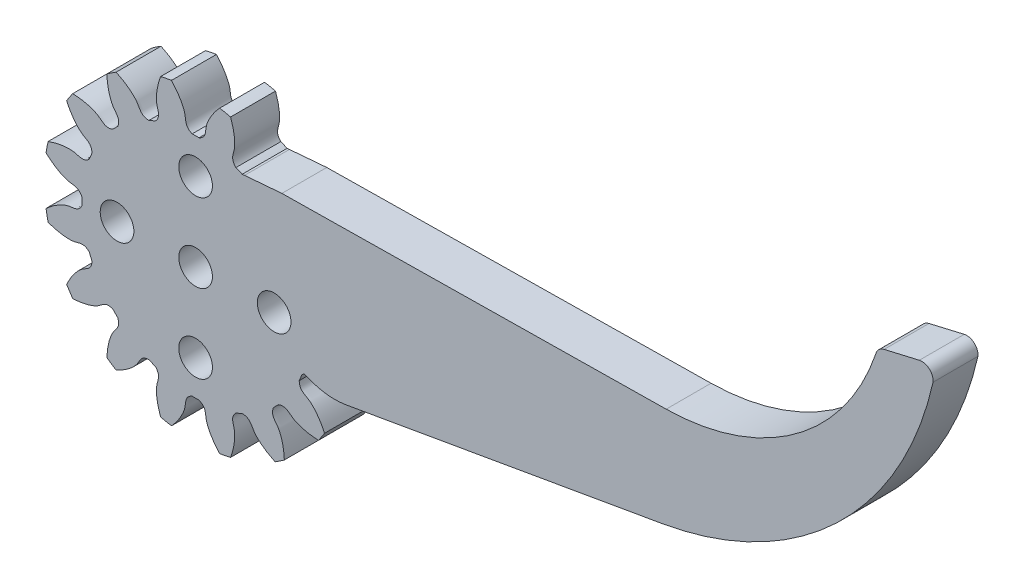
from build123d import *

# Parameters (mm, degrees)
SKETCH_1_R               = 13.5
EXTRUDE_1_DEPTH          = 4
CUT_EXTRUDE_1_DEPTH      = 20.506409203
PATTERN_CIRCULAR_1_COUNT = 16
EXTRUDE_2_DEPTH          = 4
SKETCH_6_R               = 1.5
CUT_EXTRUDE_3_DEPTH      = 5
CUT_EXTRUDE_START        = -10
CUT_EXTRUDE_4_DEPTH      = 10


with BuildPart() as part:
    # 草图1 → 凸台-拉伸1 (new body)
    with BuildSketch(Plane.XY):
        Circle(SKETCH_1_R)
    extrude(amount=EXTRUDE_1_DEPTH)

    # 草图2 → 切除-拉伸1 (cut, through all)
    with BuildSketch(Plane.XY):
        with BuildLine():
            ThreePointArc((0.305041185, 10.120403889), (0, 10.125), (-0.305041185, 10.120403889))
            add(Edge.make_bspline(
                [(-0.305041185, 10.120403889), (-0.962759204, 10.395183014), (-0.853981794, 10.906049427), (-0.967171932, 11.380214888), (-0.976804181, 11.417326349), (-0.988398148, 11.458580344), (-1.002118436, 11.503912359), (-1.018133663, 11.553251857), (-1.036608616, 11.606523545), (-1.057706516, 11.663647046), (-1.081588151, 11.724537072), (-1.108411962, 11.789103449), (-1.138333851, 11.857251186), (-1.171507068, 11.928880543), (-1.208082076, 12.003887096), (-1.248206435, 12.082161811), (-1.292024667, 12.16359112), (-1.339678142, 12.248056998), (-1.391304957, 12.335437043), (-1.447039812, 12.425604566), (-1.507013901, 12.518428671), (-1.571354794, 12.61377435), (-1.640186328, 12.711502576), (-1.713628495, 12.811470397), (-1.791797335, 12.913531035), (-1.874804837, 13.01753399), (-1.962758827, 13.123325139), (-2.055762878, 13.230746851), (-2.153916207, 13.339638085), (-2.257313584, 13.449834512), (-2.366045239, 13.561168623), (-2.480196773, 13.673469848), (-2.599849074, 13.786564671), (-2.725078231, 13.900276757), (-2.855955457, 14.01442707), (-2.99254701, 14.128833999), (-3.13491412, 14.243313486), (-3.283112918, 14.357679154), (-3.437194369, 14.471742441), (-3.597204206, 14.585312725), (-3.763182868, 14.698197468), (-3.935165451, 14.810202343), (-4.113181617, 14.92113138), (-4.361197206, 15.068878017), (-4.552482445, 15.175112164), (-4.682669973, 15.244113675)],
                knots=[0, 0, 0, 0, 0.200958108, 0.205848205, 0.211390316, 0.217584439, 0.224430575, 0.231928724, 0.240078886, 0.248881062, 0.25833525, 0.268441451, 0.279199665, 0.290609892, 0.302672132, 0.315386384, 0.32875265, 0.342770929, 0.357441221, 0.372763526, 0.388737843, 0.405364174, 0.422642518, 0.440572874, 0.459155244, 0.478389626, 0.498276022, 0.51881443, 0.540004852, 0.561847286, 0.584341734, 0.607488194, 0.631286667, 0.655737153, 0.680839653, 0.706594165, 0.73300069, 0.760059228, 0.787769779, 0.816132343, 0.84514692, 0.87481351, 0.905132113, 0.936102729, 1, 1, 1, 1], degree=3))
            ThreePointArc((-4.682669973, 15.244113675), (0, 15.947112585), (4.682669973, 15.244113675))
            add(Edge.make_bspline(
                [(0.305041185, 10.120403889), (0.962759204, 10.395183014), (0.853981794, 10.906049427), (0.967171932, 11.380214888), (0.976804181, 11.417326349), (0.988398148, 11.458580344), (1.002118436, 11.503912359), (1.018133663, 11.553251857), (1.036608616, 11.606523545), (1.057706516, 11.663647046), (1.081588151, 11.724537072), (1.108411962, 11.789103449), (1.138333851, 11.857251186), (1.171507068, 11.928880543), (1.208082076, 12.003887096), (1.248206435, 12.082161811), (1.292024667, 12.16359112), (1.339678142, 12.248056998), (1.391304957, 12.335437043), (1.447039812, 12.425604566), (1.507013901, 12.518428671), (1.571354794, 12.61377435), (1.640186328, 12.711502576), (1.713628495, 12.811470397), (1.791797335, 12.913531035), (1.874804837, 13.01753399), (1.962758827, 13.123325139), (2.055762878, 13.230746851), (2.153916207, 13.339638085), (2.257313584, 13.449834512), (2.366045239, 13.561168623), (2.480196773, 13.673469848), (2.599849074, 13.786564671), (2.725078231, 13.900276757), (2.855955457, 14.01442707), (2.99254701, 14.128833999), (3.13491412, 14.243313486), (3.283112918, 14.357679154), (3.437194369, 14.471742441), (3.597204206, 14.585312725), (3.763182868, 14.698197468), (3.935165451, 14.810202343), (4.113181617, 14.92113138), (4.361197206, 15.068878017), (4.552482445, 15.175112164), (4.682669973, 15.244113675)],
                knots=[0, 0, 0, 0, 0.200958108, 0.205848205, 0.211390316, 0.217584439, 0.224430575, 0.231928724, 0.240078886, 0.248881062, 0.25833525, 0.268441451, 0.279199665, 0.290609892, 0.302672132, 0.315386384, 0.32875265, 0.342770929, 0.357441221, 0.372763526, 0.388737843, 0.405364174, 0.422642518, 0.440572874, 0.459155244, 0.478389626, 0.498276022, 0.51881443, 0.540004852, 0.561847286, 0.584341734, 0.607488194, 0.631286667, 0.655737153, 0.680839653, 0.706594165, 0.73300069, 0.760059228, 0.787769779, 0.816132343, 0.84514692, 0.87481351, 0.905132113, 0.936102729, 1, 1, 1, 1], degree=3))
        make_face()
    cut_extrude_1 = extrude(amount=CUT_EXTRUDE_1_DEPTH, mode=Mode.SUBTRACT)

    # 阵列(圆周)1: 切除-拉伸1 ×16 about axis
    pattern_circular_1_axis = Axis((0, 0, -1.5), (0, 0, 1))
    for i in range(1, PATTERN_CIRCULAR_1_COUNT):
        add(cut_extrude_1.rotate(pattern_circular_1_axis, i * 360 / PATTERN_CIRCULAR_1_COUNT), mode=Mode.SUBTRACT)

    # 草图4 → 凸台-拉伸2 (add)
    with BuildSketch(Plane.XY.offset(4)):
        with BuildLine():
            Line((5.33526426, 9.490778921), (0, 0))
            Line((0, 0), (10.368523372, -3.673380336))
            ThreePointArc((10.368523372, -3.673380336), (11.876360742, -4.000972098), (13.417884112, -3.933181277))
            Line((13.417884112, -3.933181277), (41.599990074, 0.988346819))
            ThreePointArc((41.599990074, 0.988346819), (57.135148725, 8.8230516), (65.708990637, 23.962833242))
            ThreePointArc((65.708990637, 23.962833242), (65.379186377, 24.821045693), (64.488046266, 25.047250832))
            Line((64.488046266, 25.047250832), (61.348113668, 24.315133452))
            ThreePointArc((61.348113668, 24.315133452), (60.901777346, 24.080525768), (60.626659891, 23.657953568))
            ThreePointArc((60.626659891, 23.657953568), (53.457559724, 13.844891475), (41.931012563, 9.993801318))
            Line((41.931012563, 9.993801318), (5.33526426, 9.490778921))
        make_face()
    extrude(amount=-EXTRUDE_2_DEPTH)

    # 草图6 → 切除-拉伸3 (cut)
    with BuildSketch(Plane.XY.offset(4)):
        with Locations((0, 7)):
            Circle(SKETCH_6_R)
        with Locations((7, 0)):
            Circle(SKETCH_6_R)
        with Locations((0, -7)):
            Circle(SKETCH_6_R)
        with Locations((-7, 0)):
            Circle(SKETCH_6_R)
        Circle(SKETCH_6_R)
    extrude(amount=-CUT_EXTRUDE_3_DEPTH, mode=Mode.SUBTRACT)

    # 草图7 → 切除-拉伸4 (cut)
    with BuildSketch(Plane.XY.offset(4).offset(CUT_EXTRUDE_START)):
        with BuildLine():
            add(Edge.make_bspline(
                [(4.363387609, 9.250408825), (4.889409251, 9.341448642), (4.991661351, 9.789261216), (5.25695123, 10.155394002), (5.300647022, 10.211900205), (5.364430121, 10.287943264), (5.443318377, 10.374748767), (5.538256848, 10.471207694), (5.650123041, 10.576155048), (5.779726765, 10.688371467), (5.927806493, 10.806587349), (6.095026836, 10.929486509), (6.28197599, 11.055710125), (6.489163436, 11.183860762), (6.717017827, 11.312506521), (6.917195178, 11.415205381), (7.041497539, 11.474549412), (7.081843351, 11.493367424)],
                knots=[0.021521631, 0.021521631, 0.021521631, 0.021521631, 0.200958108, 0.205848205, 0.217584439, 0.231928724, 0.248881062, 0.268441451, 0.290609892, 0.315386384, 0.342770929, 0.372763526, 0.405364174, 0.440572874, 0.478389626, 0.51881443, 0.538120392, 0.538120392, 0.538120392, 0.538120392], degree=3))
            Line((4.363387609, 9.250408825), (7.689504283, 9.523138844))
            add(Edge.make_bspline(
                [(7.908382802, 10.94109142), (7.902362368, 10.803486972), (7.886288643, 10.579024709), (7.84924484, 10.2750834), (7.810136244, 10.034626075), (7.765063197, 9.81360387), (7.723695897, 9.645366145), (7.697479012, 9.550893467), (7.689504283, 9.523138844)],
                knots=[0.461879608, 0.461879608, 0.461879608, 0.461879608, 0.521610374, 0.559427126, 0.594635826, 0.627236474, 0.657229071, 0.669752163, 0.669752163, 0.669752163, 0.669752163], degree=3))
            ThreePointArc((7.908382802, 10.94109142), (7.500198146, 11.224839766), (7.081843351, 11.493367424))
        make_face()
    extrude(amount=CUT_EXTRUDE_4_DEPTH, mode=Mode.SUBTRACT)


solid = part.part
